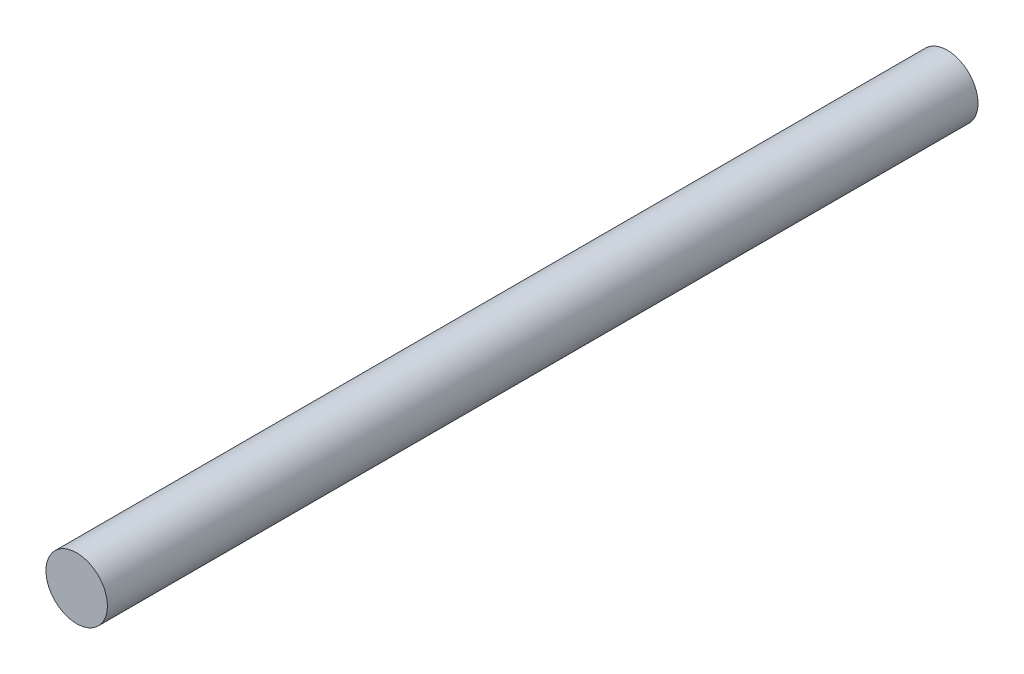
from build123d import *

# Parameters (mm, degrees)
SKETCH1_R           = 6
BOSS_EXTRUDE1_DEPTH = 85


with BuildPart() as part:
    # Sketch1 → Boss-Extrude1 (new, symmetric)
    with BuildSketch(Plane.XY):
        Circle(SKETCH1_R)
    extrude(amount=BOSS_EXTRUDE1_DEPTH, both=True)


solid = part.part
